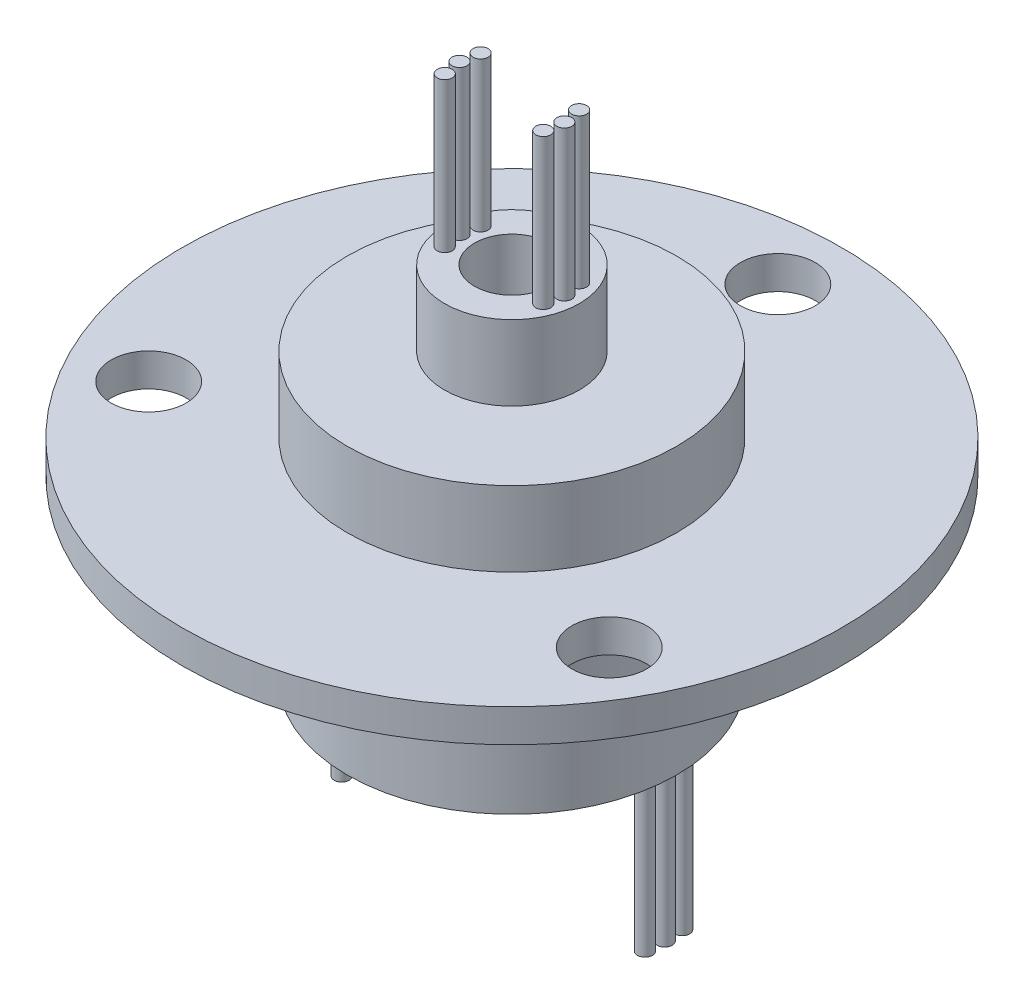
from build123d import *

# Parameters (mm, degrees)
SKETCH_1_R          = 22
SKETCH_1_R_2        = 2.5
EXTRUDE_1_DEPTH     = 2.2
SKETCH_2_R          = 11
EXTRUDE_2_DEPTH     = 5
SKETCH_3_R          = 4.5
EXTRUDE_3_DEPTH     = 5
EXTRUDE_START       = 11.8
SKETCH_4_R          = 11
EXTRUDE_4_DEPTH     = 11.8
SKETCH_5_R          = 2.5
CUT_EXTRUDE_1_DEPTH = 40.293765409
SKETCH_6_R          = 0.5
EXTRUDE_5_DEPTH     = 10
SKETCH_7_R          = 0.5
EXTRUDE_6_DEPTH     = 10


with BuildPart() as part:
    # 草圖1 → 填料-伸長1 (new body)
    with BuildSketch(Plane(origin=(0, 0, 0), x_dir=(1, 0, 0), z_dir=(0, 1, 0))):
        Circle(SKETCH_1_R)
        with Locations((0, 17.75)):
            Circle(SKETCH_1_R_2, mode=Mode.SUBTRACT)
        with Locations((15.371950917, -8.875)):
            Circle(SKETCH_1_R_2, mode=Mode.SUBTRACT)
        with Locations((-15.371950917, -8.875)):
            Circle(SKETCH_1_R_2, mode=Mode.SUBTRACT)
    extrude(amount=EXTRUDE_1_DEPTH)

    # 草圖2 → 填料-伸長2 (add)
    with BuildSketch(Plane(origin=(0, 2.2, 0), x_dir=(1, 0, 0), z_dir=(0, 1, 0))):
        Circle(SKETCH_2_R)
    extrude(amount=EXTRUDE_2_DEPTH)

    # 草圖3 → 填料-伸長3 (add)
    with BuildSketch(Plane(origin=(0, 7.2, 0), x_dir=(1, 0, 0), z_dir=(0, 1, 0))):
        Circle(SKETCH_3_R)
    extrude(amount=EXTRUDE_3_DEPTH)

    # 草圖4 → 填料-伸長4 (add)
    with BuildSketch(Plane.XZ.offset(EXTRUDE_START)):
        Circle(SKETCH_4_R)
    extrude(amount=-EXTRUDE_4_DEPTH)

    # 草圖5 → 除料-伸長1 (cut, through all)
    with BuildSketch(Plane(origin=(0, 12.2, 0), x_dir=(1, 0, 0), z_dir=(0, 1, 0))):
        Circle(SKETCH_5_R)
    extrude(amount=-CUT_EXTRUDE_1_DEPTH, mode=Mode.SUBTRACT)

    # 草圖6 → 填料-伸長5 (add)
    with BuildSketch(Plane(origin=(0, 12.2, 0), x_dir=(1, 0, 0), z_dir=(0, 1, 0))):
        with Locations((-3.5, 0)):
            Circle(SKETCH_6_R)
        with Locations((-3.288924173, 1.197070502)):
            Circle(SKETCH_6_R)
        with Locations((-3.288924173, -1.197070502)):
            Circle(SKETCH_6_R)
        with Locations((3.288924173, -1.197070502)):
            Circle(SKETCH_6_R)
        with Locations((3.5, 0)):
            Circle(SKETCH_6_R)
        with Locations((3.288924173, 1.197070502)):
            Circle(SKETCH_6_R)
    extrude(amount=EXTRUDE_5_DEPTH)

    # 草圖7 → 填料-伸長6 (add)
    with BuildSketch(Plane.XZ.offset(11.8)):
        with Locations((-10.198712902, 0)):
            Circle(SKETCH_7_R)
        with Locations((-10.122693243, 1.242910445)):
            Circle(SKETCH_7_R)
        with Locations((-10.122693243, -1.242910445)):
            Circle(SKETCH_7_R)
        with Locations((10.122693243, -1.242910445)):
            Circle(SKETCH_7_R)
        with Locations((10.198712902, 0)):
            Circle(SKETCH_7_R)
        with Locations((10.122693243, 1.242910445)):
            Circle(SKETCH_7_R)
    extrude(amount=EXTRUDE_6_DEPTH)


solid = part.part
